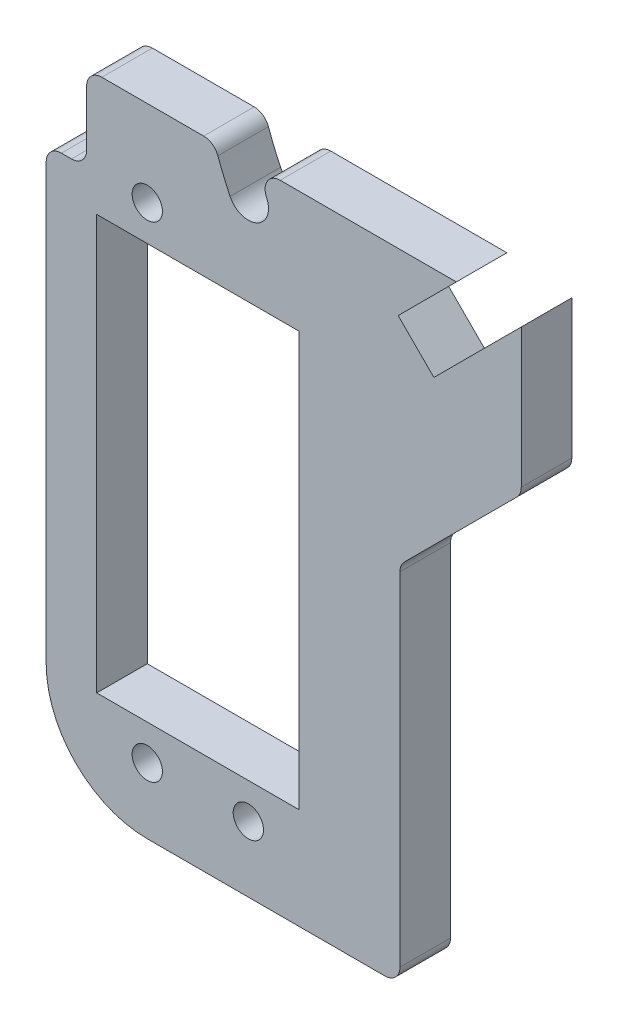
from build123d import *

# Parameters (mm, degrees)
ESQUISSE1_R        = 1.5
BOSS_EXTRU_1_DEPTH = 5
CONG_2_R           = 10
CONG_4_R           = 1.5


with BuildPart() as part:
    # Esquisse1 → Boss.-Extru.1 (new body)
    with BuildSketch(Plane.XY):
        with BuildLine():
            Line((0, 54.5), (0, 0))
            Line((0, 0), (35, 0))
            Line((35, 0), (35, 36))
            Line((35, 36), (47, 48))
            Line((47, 48), (47, 62.352588562))
            Line((47, 62.352588562), (38.354928639, 53.707517201))
            Line((38.354928639, 53.707517201), (34.819394733, 57.243051107))
            Line((34.819394733, 57.243051107), (40.576343626, 63))
            Line((40.576343626, 63), (20.884445569, 63))
            ThreePointArc((20.884445569, 63), (21.318813491, 61.92160006), (21.797998705, 60.862353415))
            ThreePointArc((21.797998705, 60.862353415), (20.855817114, 58.195464994), (18.188928693, 59.137646585))
            ThreePointArc((18.188928693, 59.137646585), (17.446005834, 60.81528669), (16.801286837, 62.533060863))
            ThreePointArc((16.801286837, 62.533060863), (16.76008839, 62.764916748), (16.746292441, 63))
            Line((16.746292441, 63), (4, 63))
            Line((4, 63), (4, 54.5))
            Line((4, 54.5), (0, 54.5))
        make_face()
        with Locations((10, 6.5)):
            Circle(ESQUISSE1_R, mode=Mode.SUBTRACT)
        with Locations((20, 6.5)):
            Circle(ESQUISSE1_R, mode=Mode.SUBTRACT)
        Polygon((5, 51), (15, 51), (25, 51), (25, 10), (5, 10), align=None, mode=Mode.SUBTRACT)
        with Locations((10, 54.5)):
            Circle(ESQUISSE1_R, mode=Mode.SUBTRACT)
    extrude(amount=BOSS_EXTRU_1_DEPTH)

    # Congé2
    cong_2_edges = [part.edges().sort_by_distance(p)[0] for p in [
        (0, 0, 2.5),
    ]]
    fillet(cong_2_edges, radius=CONG_2_R)

    # Congé4
    cong_4_edges = [part.edges().sort_by_distance(p)[0] for p in [
        (0, 54.5, 2.5),
        (4, 54.5, 2.5),
        (47, 48, 2.5),
        (35, 36, 2.5),
        (35, 0, 2.5),
        (20.884445569, 63, 2.5),
        (16.746292441, 63, 2.5),
        (4, 63, 2.5),
    ]]
    fillet(cong_4_edges, radius=CONG_4_R)


solid = part.part
